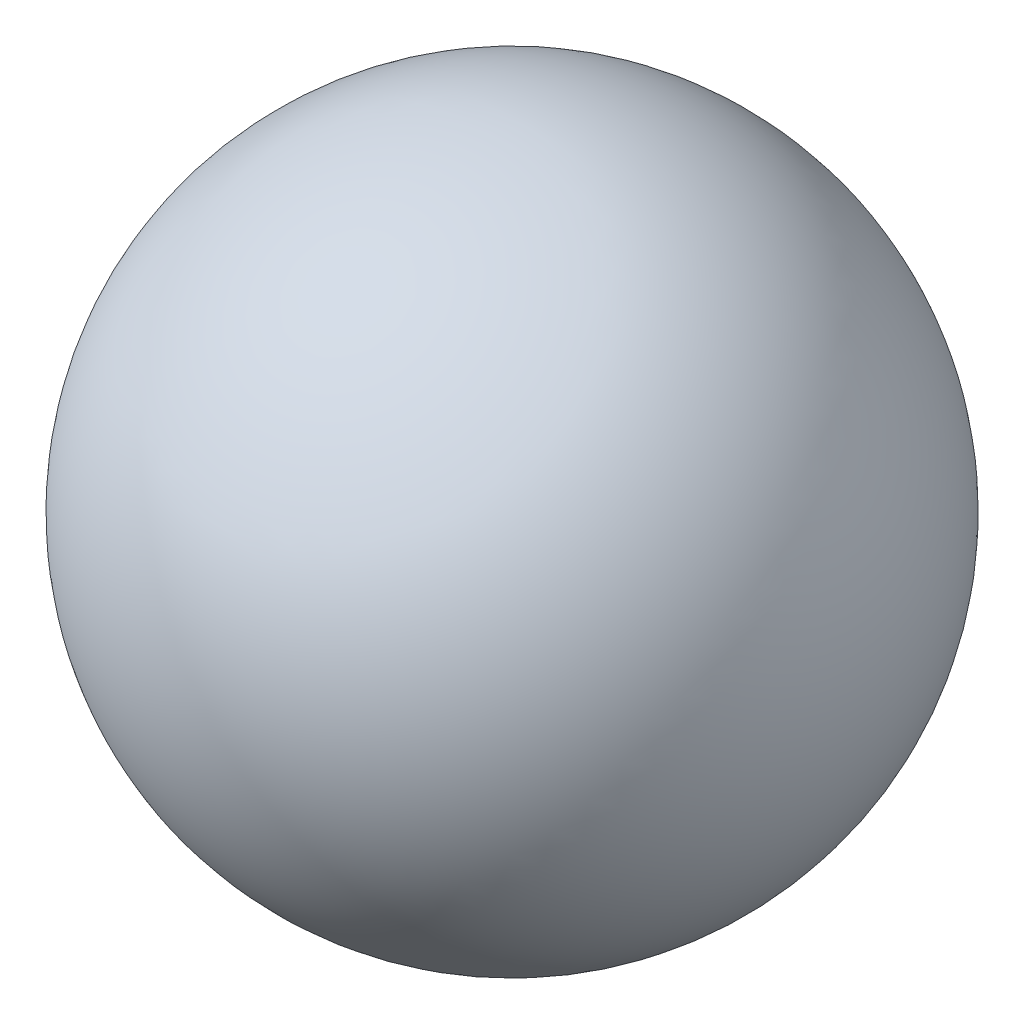
from build123d import *


with BuildPart() as part:
    # Sketch1 → Revolve1 (revolve)
    with BuildSketch(Plane(origin=(0, 0, 0), x_dir=(0, 0, -1), z_dir=(1, 0, 0))):
        with BuildLine():
            Line((-2.5, 0), (2.5, 0))
            ThreePointArc((2.5, 0), (0, 2.5), (-2.5, 0))
        make_face()
    revolve(axis=Axis((0, 0, 0), (0, 0, 1)))


solid = part.part
